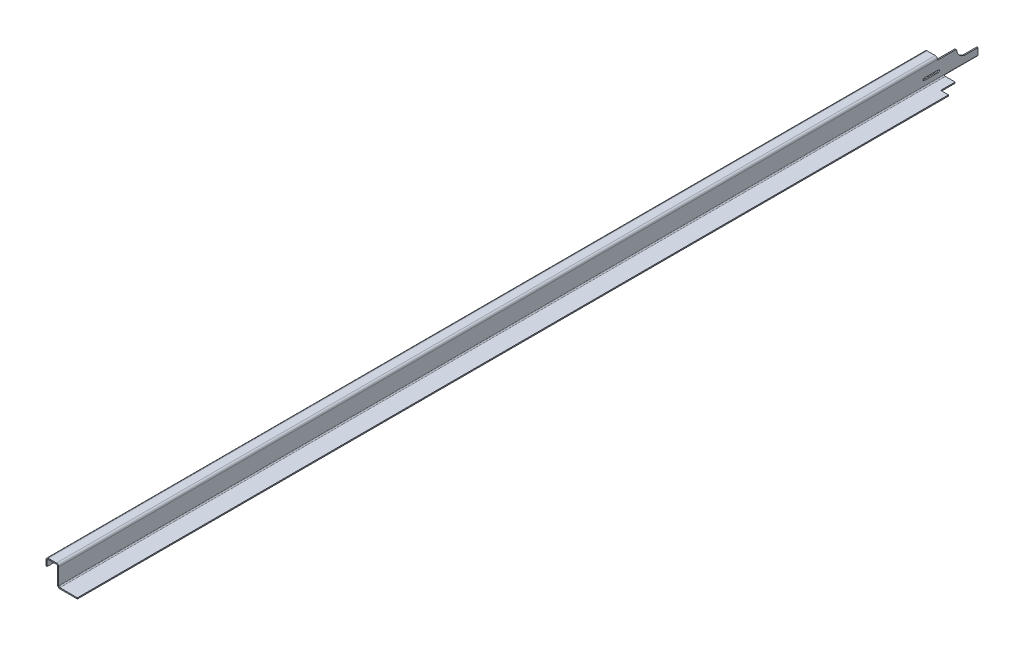
from build123d import *

# Parameters (mm, degrees)
SM_BASE_FLANGE_1_DEPTH           = 8
SM_EDGE_FLANGE_1_STRIP_W         = 48
SM_EDGE_FLANGE_1_STRIP_H         = 8
SM_EDGE_FLANGE_1_STRIP_CUT_DEPTH = 6215
SM_EDGE_FLANGE_1_DEPTH           = 6215
SM_EDGE_FLANGE_2_STRIP_W         = 48
SM_EDGE_FLANGE_2_STRIP_H         = 8
SM_EDGE_FLANGE_2_STRIP_CUT_DEPTH = 6215
SM_EDGE_FLANGE_2_DEPTH           = 6215
SM_EDGE_FLANGE_3_STRIP_W         = 48
SM_EDGE_FLANGE_3_STRIP_H         = 8
SM_EDGE_FLANGE_3_STRIP_CUT_DEPTH = 6500
SM_EDGE_FLANGE_3_DEPTH           = 6500
FILLET_1_R                       = 10
CUT_EXTRUDE_START                = -6500
CUT_EXTRUDE_3_DEPTH              = 238
CUT_EXTRUDE_START_2              = -6262
CUT_EXTRUDE_3_2_OUTLINE_W        = 55
CUT_EXTRUDE_3_2_OUTLINE_H        = 8
CUT_EXTRUDE_3_2_DEPTH            = 102


# Read off the part's stored shape, not the designer's step: 切除-拉伸3
# Sheet-metal steps are written as plain solids
with BuildPart() as part:
    # Sketch 1 → 基体-法兰1 (new body)
    with BuildSketch(Plane(origin=(0, 0, 0), x_dir=(0, 0, -1), z_dir=(1, 0, 0))):
        with BuildLine():
            Line((0, 0), (6215, 0))
            Line((6215, 0), (6215, -20))
            Line((6215, -20), (6350.001923105, -20))
            ThreePointArc((6350.001923105, -20), (6368.861621181, -66.284822813), (6415, -85.5))
            Line((6415, -85.5), (6500, -85.5))
            Line((6500, -85.5), (6500, -147))
            Line((6500, -147), (0, -147))
            Line((0, -147), (0, 0))
        make_face()
        with BuildLine():
            Line((6120, -82.5), (6220, -82.5))
            ThreePointArc((6220, -82.5), (6227.5, -90), (6220, -97.5))
            Line((6220, -97.5), (6120, -97.5))
            ThreePointArc((6120, -97.5), (6112.5, -90), (6120, -82.5))
        make_face(mode=Mode.SUBTRACT)
    extrude(amount=-SM_BASE_FLANGE_1_DEPTH)

    # 边线-法兰1 strip (across the edge) → 边线-法兰1 strip cut (cut)
    with BuildSketch(Plane(origin=(-8, 0, 0), x_dir=(0, -1, 0), z_dir=(0, 0, -1))):
        with Locations((-8, -4)):
            Rectangle(SM_EDGE_FLANGE_1_STRIP_W, SM_EDGE_FLANGE_1_STRIP_H)
    extrude(amount=SM_EDGE_FLANGE_1_STRIP_CUT_DEPTH, mode=Mode.SUBTRACT)

    # 边线-法兰1 section (across the edge) → 边线-法兰1 (add)
    with BuildSketch(Plane(origin=(-8, 0, 0), x_dir=(0, -1, 0), z_dir=(0, 0, -1))):
        with BuildLine():
            Line((0, 8), (0, 74))
            Line((0, 74), (8, 74))
            Line((8, 74), (8, 8))
            ThreePointArc((8, 8), (10.343145751, 2.343145751), (16, 0))
            Line((16, 0), (16, -8))
            ThreePointArc((16, -8), (4.686291501, -3.313708499), (0, 8))
        make_face()
    extrude(amount=SM_EDGE_FLANGE_1_DEPTH)

    # 边线-法兰2 strip (across the edge) → 边线-法兰2 strip cut (cut)
    with BuildSketch(Plane(origin=(-82, -8, 0), x_dir=(1, 0, 0), z_dir=(0, 0, -1))):
        with Locations((-16, -4)):
            Rectangle(SM_EDGE_FLANGE_2_STRIP_W, SM_EDGE_FLANGE_2_STRIP_H)
    extrude(amount=SM_EDGE_FLANGE_2_STRIP_CUT_DEPTH, mode=Mode.SUBTRACT)

    # 边线-法兰2 section (across the edge) → 边线-法兰2 (add)
    with BuildSketch(Plane(origin=(-82, -8, 0), x_dir=(1, 0, 0), z_dir=(0, 0, -1))):
        with BuildLine():
            Line((-8, 8), (-8, 47))
            Line((-8, 47), (0, 47))
            Line((0, 47), (0, 8))
            ThreePointArc((0, 8), (2.343145751, 2.343145751), (8, 0))
            Line((8, 0), (8, -8))
            ThreePointArc((8, -8), (-3.313708499, -3.313708499), (-8, 8))
        make_face()
    extrude(amount=SM_EDGE_FLANGE_2_DEPTH)

    # 边线-法兰3 strip (across the edge) → 边线-法兰3 strip cut (cut)
    with BuildSketch(Plane(origin=(0, -147, 0), x_dir=(0, 1, 0), z_dir=(0, 0, -1))):
        with Locations((-8, -4)):
            Rectangle(SM_EDGE_FLANGE_3_STRIP_W, SM_EDGE_FLANGE_3_STRIP_H)
    extrude(amount=SM_EDGE_FLANGE_3_STRIP_CUT_DEPTH, mode=Mode.SUBTRACT)

    # 边线-法兰3 section (across the edge) → 边线-法兰3 (add)
    with BuildSketch(Plane(origin=(0, -147, 0), x_dir=(0, 1, 0), z_dir=(0, 0, -1))):
        with BuildLine():
            Line((0, 8), (0, 132))
            Line((0, 132), (8, 132))
            Line((8, 132), (8, 8))
            ThreePointArc((8, 8), (10.343145751, 2.343145751), (16, 0))
            Line((16, 0), (16, -8))
            ThreePointArc((16, -8), (4.686291501, -3.313708499), (0, 8))
        make_face()
    extrude(amount=SM_EDGE_FLANGE_3_DEPTH)

    # 圆角1
    fillet_1_edges = [part.edges().sort_by_distance(p)[0] for p in [
        (-86, -55, -6215),
        (-4, -20, -6350.001923105),
    ]]
    fillet(fillet_1_edges, radius=FILLET_1_R)

    # 切除-拉伸3 outline → 切除-拉伸3 (cut)
    with BuildSketch(Plane.XY.offset(CUT_EXTRUDE_START)):
        with BuildLine():
            Line((8, -147), (132, -147))
            Line((132, -147), (132, -139))
            Line((132, -139), (8, -139))
            ThreePointArc((8, -139), (3.527864045, -137.63324958), (0.583801513, -134))
            Line((0.583801513, -134), (-6.832396974, -137))
            ThreePointArc((-6.832396974, -137), (-0.94427191, -144.266499161), (8, -147))
        make_face()
    extrude(amount=CUT_EXTRUDE_3_DEPTH, mode=Mode.SUBTRACT)

    # Cut-Extrude 3 2 outline → Cut-Extrude 3 2 (cut)
    with BuildSketch(Plane.XY.offset(CUT_EXTRUDE_START_2)):
        with Locations((104.5, -143)):
            Rectangle(CUT_EXTRUDE_3_2_OUTLINE_W, CUT_EXTRUDE_3_2_OUTLINE_H)
    extrude(amount=CUT_EXTRUDE_3_2_DEPTH, mode=Mode.SUBTRACT)


solid = part.part
